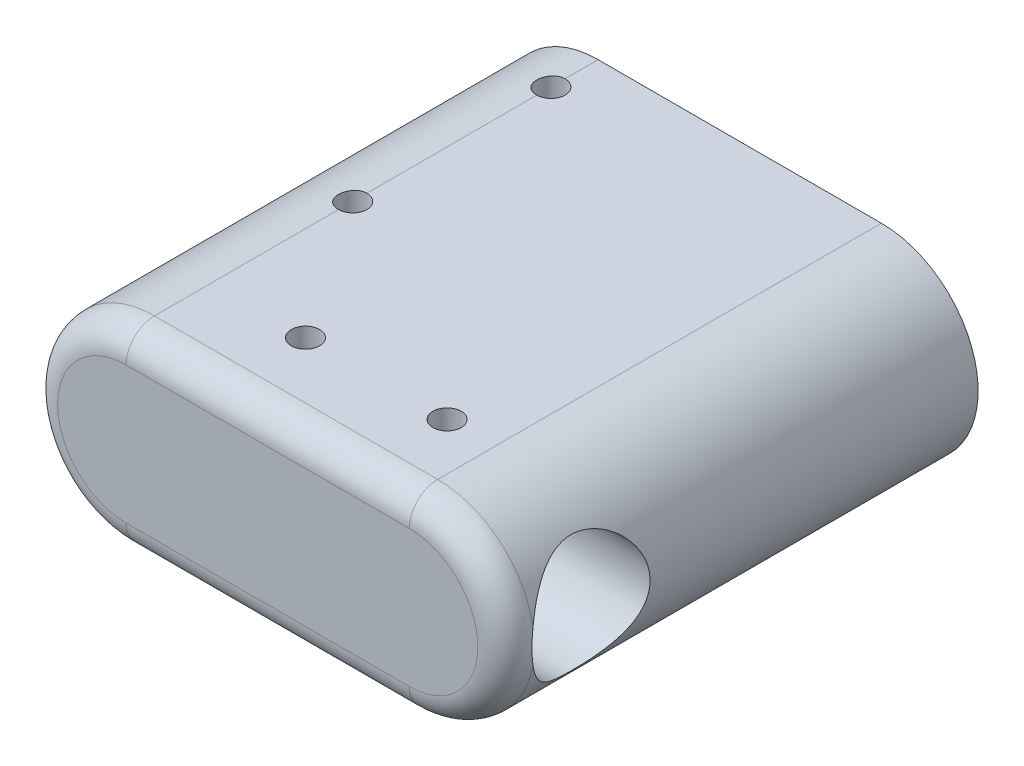
from build123d import *

# Parameters (mm, degrees)
SKETCH1_R           = 6.25
SKETCH1_R_2         = 4.15
BOSS_EXTRUDE1_DEPTH = 50
CUT_EXTRUDE1_DEPTH  = 127
BOSS_EXTRUDE2_DEPTH = 20
SKETCH4_R           = 6.25
CUT_EXTRUDE2_DEPTH  = 20
CUT_EXTRUDE3_START  = -30
SKETCH5_R           = 6.25
CUT_EXTRUDE3_DEPTH  = 30
FILLET1_R           = 3
SKETCH6_R           = 4.5
BOSS_EXTRUDE3_DEPTH = 30
SKETCH7_R           = 1.5
CUT_EXTRUDE4_DEPTH  = 30
CUT_EXTRUDE5_DEPTH  = 2
CUT_EXTRUDE6_START  = -30
SKETCH9_R           = 4.5
CUT_EXTRUDE6_DEPTH  = 30


with BuildPart() as part:
    # Sketch1 → Boss-Extrude1 (new body)
    with BuildSketch(Plane.XY):
        with BuildLine():
            Line((-73.62208004, 11.83829087), (106.37791996, 11.83829087))
            ThreePointArc((106.37791996, 11.83829087), (116.62791996, 1.58829087), (106.37791996, -8.66170913))
            Line((106.37791996, -8.66170913), (-73.62208004, -8.66170913))
            ThreePointArc((-73.62208004, -8.66170913), (-83.87208004, 1.58829087), (-73.62208004, 11.83829087))
        make_face()
        with Locations((-73.62208004, 1.58829087)):
            Circle(SKETCH1_R, mode=Mode.SUBTRACT)
        with Locations((-43.62208004, 1.58829087)):
            Circle(SKETCH1_R_2, mode=Mode.SUBTRACT)
        with Locations(Location((76.37791996, 1.58829087, 0), (0, 0, 180))):
            Circle(SKETCH1_R_2, mode=Mode.SUBTRACT)
        with Locations(Location((106.37791996, 1.58829087, 0), (0, 0, 180))):
            Circle(SKETCH1_R, mode=Mode.SUBTRACT)
    extrude(amount=BOSS_EXTRUDE1_DEPTH)

    # Sketch2 → Cut-Extrude1 (cut)
    with BuildSketch(Plane.XY.offset(50)):
        with BuildLine():
            Line((-43.62208004, 11.83829087), (132.206329773, 11.83829087))
            Line((132.206329773, 11.83829087), (132.206329773, -8.66170913))
            Line((132.206329773, -8.66170913), (-43.62208004, -8.66170913))
            ThreePointArc((-43.62208004, -8.66170913), (-33.37208004, 1.58829087), (-43.62208004, 11.83829087))
        make_face()
    extrude(amount=-CUT_EXTRUDE1_DEPTH, mode=Mode.SUBTRACT)

    # Sketch3 → Boss-Extrude2 (add)
    with BuildSketch(Plane.XY.offset(50)):
        with BuildLine():
            Line((-43.62208004, 11.83829087), (-73.62208004, 11.83829087))
            ThreePointArc((-73.62208004, 11.83829087), (-83.87208004, 1.58829087), (-73.62208004, -8.66170913))
            Line((-73.62208004, -8.66170913), (-43.62208004, -8.66170913))
            ThreePointArc((-43.62208004, -8.66170913), (-33.37208004, 1.58829087), (-43.62208004, 11.83829087))
        make_face()
    extrude(amount=-BOSS_EXTRUDE2_DEPTH)

    # Sketch4 → Cut-Extrude2 (cut)
    with BuildSketch(Plane.ZY.offset(43.62208004)):
        with Locations(Location((41, 1.58829087, 0), (0, 0, 270))):
            Circle(SKETCH4_R)
    extrude(amount=-CUT_EXTRUDE2_DEPTH, mode=Mode.SUBTRACT)

    # Sketch5 → Cut-Extrude3 (cut)
    with BuildSketch(Plane(origin=(-43.62208004, 0, 0), x_dir=(0, 0, -1), z_dir=(1, 0, 0)).offset(CUT_EXTRUDE3_START)):
        with Locations(Location((-41, 1.58829087, 0), (0, 0, 270))):
            Circle(SKETCH5_R)
    extrude(amount=CUT_EXTRUDE3_DEPTH, mode=Mode.SUBTRACT)

    # Fillet1
    # the kernel refuses this fillet: 3 mm, written as the material it takes off along each edge
    with BuildSketch(Plane(origin=(-73.62208004, 11.83829087, 50), x_dir=(0, 0, -1), z_dir=(1, 0, 0)), Plane(origin=(-43.62208004, -8.66170913, 50), x_dir=(0, 0, -1), z_dir=(-1, 0, 0))) as fillet1_piece_1:
        with BuildLine():
            CenterArc((FILLET1_R, -FILLET1_R), FILLET1_R, 90, 90)
            Line((0, -FILLET1_R), (0, 0))
            Line((0, 0), (FILLET1_R, 0))
        make_face()
    extrude(amount=30, mode=Mode.SUBTRACT)
    with BuildSketch(Plane(origin=(-73.62208004, 1.58829087, 50), x_dir=(0, -1, 0), z_dir=(1, 0, 0))) as fillet1_piece_2:
        with BuildLine():
            CenterArc((10.25 - FILLET1_R, FILLET1_R), FILLET1_R, 270, 90)
            Line((10.25, FILLET1_R), (10.25, 0))
            Line((10.25, 0), (10.25 - FILLET1_R, 0))
        make_face()
    revolve(axis=Axis((-73.62208004, 1.58829087, 50), (0, 0, -1)), revolution_arc=180, mode=Mode.SUBTRACT)
    with BuildSketch(Plane(origin=(-43.62208004, 1.58829087, 50), x_dir=(0, -1, 0), z_dir=(-1, 0, 0))) as fillet1_piece_3:
        with BuildLine():
            CenterArc((10.25 - FILLET1_R, -FILLET1_R), FILLET1_R, 0, 90)
            Line((10.25 - FILLET1_R, 0), (10.25, 0))
            Line((10.25, 0), (10.25, -FILLET1_R))
        make_face()
    revolve(axis=Axis((-43.62208004, 1.58829087, 50), (0, 0, 1)), revolution_arc=180, mode=Mode.SUBTRACT)

    # Sketch6 → Boss-Extrude3 (add)
    with BuildSketch(Plane(origin=(0, 0, 30), x_dir=(-1, 0, 0), z_dir=(0, 0, -1))):
        with Locations(Location((73.62208004, 1.58829087, 0), (0, 0, 180))):
            Circle(SKETCH6_R)
    extrude(amount=BOSS_EXTRUDE3_DEPTH)

    # Sketch7 → Cut-Extrude4 (cut)
    with BuildSketch(Plane(origin=(0, 11.83829087, 0), x_dir=(1, 0, 0), z_dir=(0, 1, 0))):
        with Locations(Location((-48.62208004, -41, 0), (0, 0, 180))):
            Circle(SKETCH7_R)
        with Locations(Location((-63.62208004, -41, 0), (0, 0, 180))):
            Circle(SKETCH7_R)
        with Locations(Location((-73.62208004, -26, 0), (0, 0, 180))):
            Circle(SKETCH7_R)
        with Locations(Location((-73.62208004, -5, 0), (0, 0, 180))):
            Circle(SKETCH7_R)
    extrude(amount=-CUT_EXTRUDE4_DEPTH, mode=Mode.SUBTRACT)

    # Sketch8 → Cut-Extrude5 (cut)
    with BuildSketch(Plane(origin=(0, -8.66170913, 0), x_dir=(-1, 0, 0), z_dir=(0, -1, 0))):
        Polygon((73.62208004, -8.175426481), (76.37208004, -6.58771324), (76.37208004, -3.41228676), (73.62208004, -1.824573519), (70.87208004, -3.41228676), (70.87208004, -6.58771324), align=None)
        Polygon((73.62208004, -29.175426481), (76.37208004, -27.58771324), (76.37208004, -24.41228676), (73.62208004, -22.824573519), (70.87208004, -24.41228676), (70.87208004, -27.58771324), align=None)
        Polygon((63.62208004, -44.175426481), (66.37208004, -42.58771324), (66.37208004, -39.41228676), (63.62208004, -37.824573519), (60.87208004, -39.41228676), (60.87208004, -42.58771324), align=None)
        Polygon((48.62208004, -44.175426481), (51.37208004, -42.58771324), (51.37208004, -39.41228676), (48.62208004, -37.824573519), (45.87208004, -39.41228676), (45.87208004, -42.58771324), align=None)
    extrude(amount=-CUT_EXTRUDE5_DEPTH, mode=Mode.SUBTRACT)

    # Sketch9 → Cut-Extrude6 (cut)
    with BuildSketch(Plane(origin=(0, 0, 0), x_dir=(-1, 0, 0), z_dir=(0, 0, -1)).offset(CUT_EXTRUDE6_START)):
        with Locations((73.62208004, 1.58829087)):
            Circle(SKETCH9_R)
    extrude(amount=CUT_EXTRUDE6_DEPTH, mode=Mode.SUBTRACT)


solid = part.part
